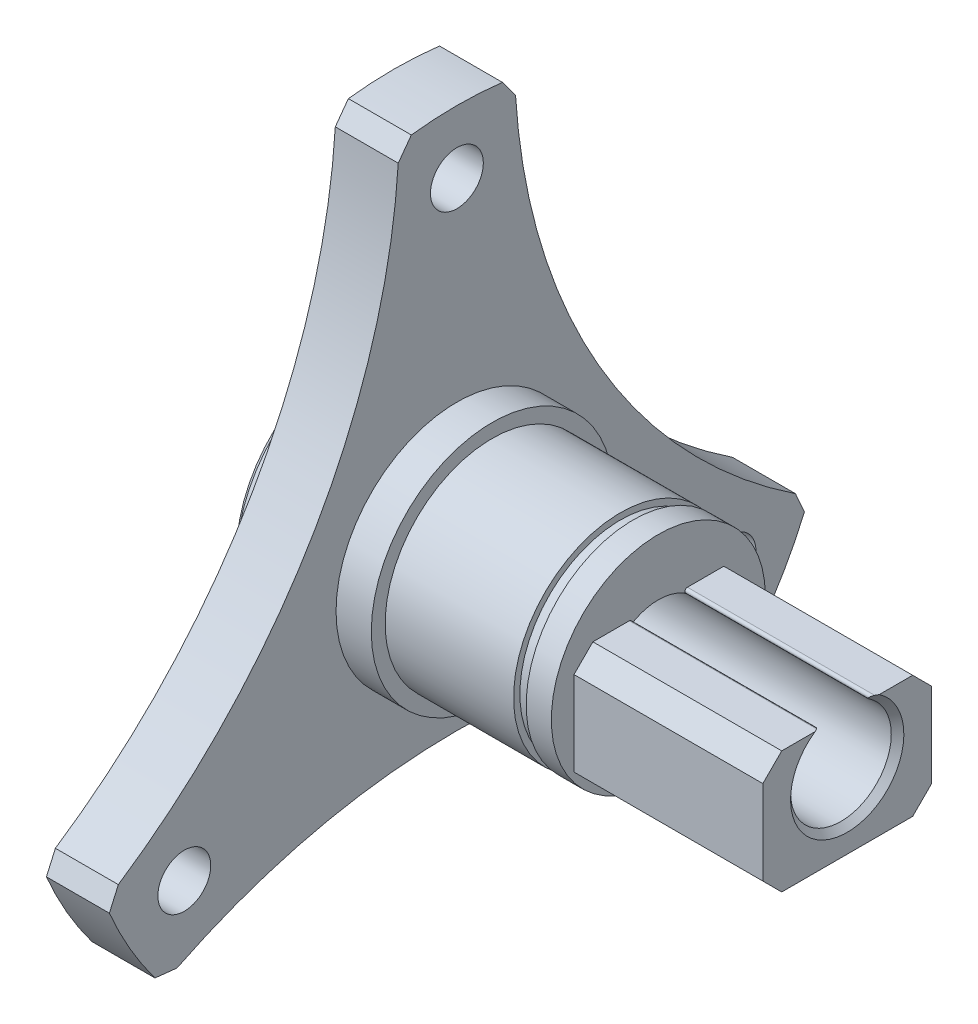
from build123d import *

# Parameters (mm, degrees)
SKETCH_2_R               = 4
CUT_EXTRUDE_1_DEPTH      = 49.744230428
CUT_EXTRUDE_START        = -8
SKETCH_3_R               = 8
CUT_EXTRUDE_2_DEPTH      = 8
CHAMFER_1_SIZE2          = 2.309401077
CHAMFER_1_SIZE           = 4
HOLE_WIZARD_M5_1_D       = 4.2
CUT_EXTRUDE_3_DEPTH      = 48.339201514
PATTERN_CIRCULAR_1_COUNT = 3
CHAMFER_4_SIZE           = 0.5
EXTRUDE_START            = 15
EXTRUDE_1_DEPTH          = 15
CHAMFER_5_SIZE           = 1.5
CHAMFER_6_SIZE           = 0.5
FILLET_1_R               = 0.2


# Some blends are built 0.0001 mm under size
with BuildPart() as part:
    # 草图1 → 旋转1 (revolve)
    with BuildSketch(Plane.XY, mode=Mode.PRIVATE) as revolve_1_sk:
        Polygon((0, 0), (0, 10), (3, 10), (3, 30), (8, 30), (8, 9.6), (10.8, 9.6), (10.8, 8.5), (21, 8.5), (21, 8), (22, 8), (22, 8.5), (24, 8.5), (24, 0), align=None)
    revolve(revolve_1_sk.sketch.rotate(Axis((24, 0, 0), (-1, 0, 0)), 90), axis=Axis((24, 0, 0), (-1, 0, 0)))

    # 草图2 → 切除-拉伸1 (cut, through all)
    with BuildSketch(Plane(origin=(24, 0, 0), x_dir=(0, 0, -1), z_dir=(1, 0, 0))):
        Circle(SKETCH_2_R)
    extrude(amount=-CUT_EXTRUDE_1_DEPTH, mode=Mode.SUBTRACT)

    # 草图3 → 切除-拉伸2 (cut)
    with BuildSketch(Plane.ZY.offset(CUT_EXTRUDE_START)):
        with Locations(Location((0, 0, 0), (0, 0, 180))):
            Circle(SKETCH_3_R)
    extrude(amount=CUT_EXTRUDE_2_DEPTH, mode=Mode.SUBTRACT)

    # 倒角1
    chamfer_1_edges = [part.edges().sort_by_distance(p)[0] for p in [
        (8, 0, 4),
    ]]
    chamfer_1_side = [part.faces().sort_by_distance(p)[0] for p in [
        (8, 0, 4.046188022),
    ]]
    chamfer(chamfer_1_edges, length=CHAMFER_1_SIZE - 0.0001, length2=CHAMFER_1_SIZE2 - 0.0001, reference=chamfer_1_side[0])  # a hair under: the kernel refuses the full size

    # M5 螺纹孔1 (through all)
    with Locations(Plane(origin=(3, 25, 0), x_dir=(0, 0, -1), z_dir=(-1, 0, 0))):
        with Locations((0, 0), (-21.650635095, 37.5), (21.650635095, 37.5)):
            Hole(HOLE_WIZARD_M5_1_D / 2)

    # 草图4 → 切除-拉伸3 (cut, through all)
    with BuildSketch(Plane.ZY.offset(-3)):
        with BuildLine():
            ThreePointArc((-27.710194429, -21.380952381), (0, -35), (27.710194429, -21.380952381))
            ThreePointArc((27.710194429, -21.380952381), (0, -13), (-27.710194429, -21.380952381))
        make_face()
    cut_extrude_3 = extrude(amount=-CUT_EXTRUDE_3_DEPTH, mode=Mode.SUBTRACT)

    # 阵列(圆周)1: 切除-拉伸3 ×3 about axis
    pattern_circular_1_axis = Axis((0, 0, 0), (1, 0, 0))
    for i in range(1, PATTERN_CIRCULAR_1_COUNT):
        add(cut_extrude_3.rotate(pattern_circular_1_axis, i * 360 / PATTERN_CIRCULAR_1_COUNT), mode=Mode.SUBTRACT)

    # 倒角2
    # the kernel refuses this chamfer: 1.262336382, 1 mm, written as the material it takes off along each edge
    with BuildSketch(Plane(origin=(-0.323534522, -18.801587302, -23.377346191), x_dir=(0, 0.7894182220381707, -0.6138557409637001), z_dir=(1, 0, 0)), Plane(origin=(-0.323534522, -10.844582024, 27.97132533), x_dir=(0, -0.9263237769525716, -0.3767283640135453), z_dir=(1, 0, 0)), Plane(origin=(-0.323534522, 29.646169325, -4.593979139), x_dir=(0, 0.13690555491440626, 0.9905841049772496), z_dir=(1, 0, 0))) as chamfer_2_piece_1:
        with BuildLine():
            Line((0.983994902, 0), (-0.239625676, 1.264429883))
            ThreePointArc((-0.239625676, 1.264429883), (-0.119678092, 0.653717986), (0, 0))
            ThreePointArc((0, 0), (0.509546154, -0.004029497), (0.983994902, 0))
        make_face()
    extrude(amount=11.647069044, mode=Mode.SUBTRACT)
    with BuildSketch(Plane(origin=(-0.323534522, -10.844582024, -27.97132533), x_dir=(0, 0.5426204152715339, 0.8399780264569711), z_dir=(1, 0, 0)), Plane(origin=(-0.323534522, 29.646169325, 4.593979139), x_dir=(0, -0.9987525171682211, 0.04993405100872917), z_dir=(1, 0, 0))) as chamfer_2_piece_2:
        with BuildLine():
            Line((1.28693566, 0), (-0.183218517, 0.966786917))
            ThreePointArc((-0.183218517, 0.966786917), (-0.098835833, 0.499884984), (0, 0))
            ThreePointArc((0, 0), (0.664569743, 0.004136227), (1.28693566, 0))
        make_face()
    extrude(amount=11.647069044, mode=Mode.SUBTRACT)
    with BuildSketch(Plane(origin=(-0.323534522, -18.801587302, 23.377346191), x_dir=(0, 0.7894182220381672, 0.6138557409637047), z_dir=(1, 0, 0))) as chamfer_2_piece_3:
        with BuildLine():
            Line((0.983994902, 0), (-0.239625676, -1.264429883))
            ThreePointArc((-0.239625676, -1.264429883), (-0.119678092, -0.653717986), (0, 0))
            ThreePointArc((0, 0), (0.509546154, 0.004029497), (0.983994902, 0))
        make_face()
    extrude(amount=11.647069044, mode=Mode.SUBTRACT)

    # 倒角4
    chamfer_4_edges = [part.edges().sort_by_distance(p)[0] for p in [
        (0, 0, 10),
    ]]
    chamfer(chamfer_4_edges, length=CHAMFER_4_SIZE)

    # 草图7 → 凸台-拉伸1 (add)
    with BuildSketch(Plane(origin=(24, 0, 0), x_dir=(0, 0, -1), z_dir=(1, 0, 0)).offset(EXTRUDE_START)):
        with BuildLine():
            Line((-6.7, -6), (6.7, -6))
            Line((6.7, -6), (6.7, 3.708099244))
            Line((6.7, 3.708099244), (1.5, 3.708099244))
            ThreePointArc((1.5, 3.708099244), (0, -4), (-1.5, 3.708099244))
            Line((-1.5, 3.708099244), (-6.7, 3.708099244))
            Line((-6.7, 3.708099244), (-6.7, -6))
        make_face()
    extrude(amount=-EXTRUDE_1_DEPTH)

    # 倒角5
    # the kernel refuses this chamfer: 1.5 mm, written as the material it takes off along each edge
    with BuildSketch(Plane(origin=(42.857524482, 3.708099244, 6.7), x_dir=(0, 0, -1), z_dir=(-1, 0, 0)), Plane(origin=(42.857524482, -6, 6.7), x_dir=(0, 1, 0), z_dir=(-1, 0, 0))) as chamfer_5_piece_1:
        Polygon((CHAMFER_5_SIZE, 0), (0, CHAMFER_5_SIZE), (0, 0), align=None)
    extrude(amount=18.857524482, mode=Mode.SUBTRACT)
    with BuildSketch(Plane(origin=(42.857524482, -6, -6.7), x_dir=(0, 1, 0), z_dir=(-1, 0, 0)), Plane(origin=(42.857524482, 3.708099244, -6.7), x_dir=(0, 0, 1), z_dir=(-1, 0, 0))) as chamfer_5_piece_2:
        Polygon((CHAMFER_5_SIZE, 0), (0, -CHAMFER_5_SIZE), (0, 0), align=None)
    extrude(amount=18.857524482, mode=Mode.SUBTRACT)

    # 倒角6
    chamfer_6_edges = [part.edges().sort_by_distance(p)[0] for p in [
        (39, -4, 0),
    ]]
    chamfer(chamfer_6_edges, length=CHAMFER_6_SIZE)

    # 圆角1
    # the kernel refuses this fillet: 0.2 mm, written as the material it takes off along each edge
    with BuildSketch(Plane(origin=(40.52345201, 3.708099244, 1.5), x_dir=(0, -0.464696875551773, 0.8854698266188521), z_dir=(-1, 0, 0))) as fillet_1_piece_1:
        with BuildLine():
            CenterArc((0.809621655, 0.199022765), FILLET_1_R, 117.690606121, 146.643100594)
            Line((0.71668228, 0.376116731), (0, 0))
            ThreePointArc((0, 0), (0.394937393, 0.019544692), (0.789874786, 0))
        make_face()
    extrude(amount=16.52345201, mode=Mode.SUBTRACT)
    with BuildSketch(Plane(origin=(40.52345201, 3.708099244, -1.5), x_dir=(0, -0.46469687555177314, -0.885469826618852), z_dir=(-1, 0, 0))) as fillet_1_piece_2:
        with BuildLine():
            CenterArc((0.809621655, -0.199022765), FILLET_1_R, 95.666293284, 146.643100594)
            Line((0.71668228, -0.376116731), (0, 0))
            ThreePointArc((0, 0), (0.394937393, -0.019544692), (0.789874786, 0))
        make_face()
    extrude(amount=16.52345201, mode=Mode.SUBTRACT)


solid = part.part
